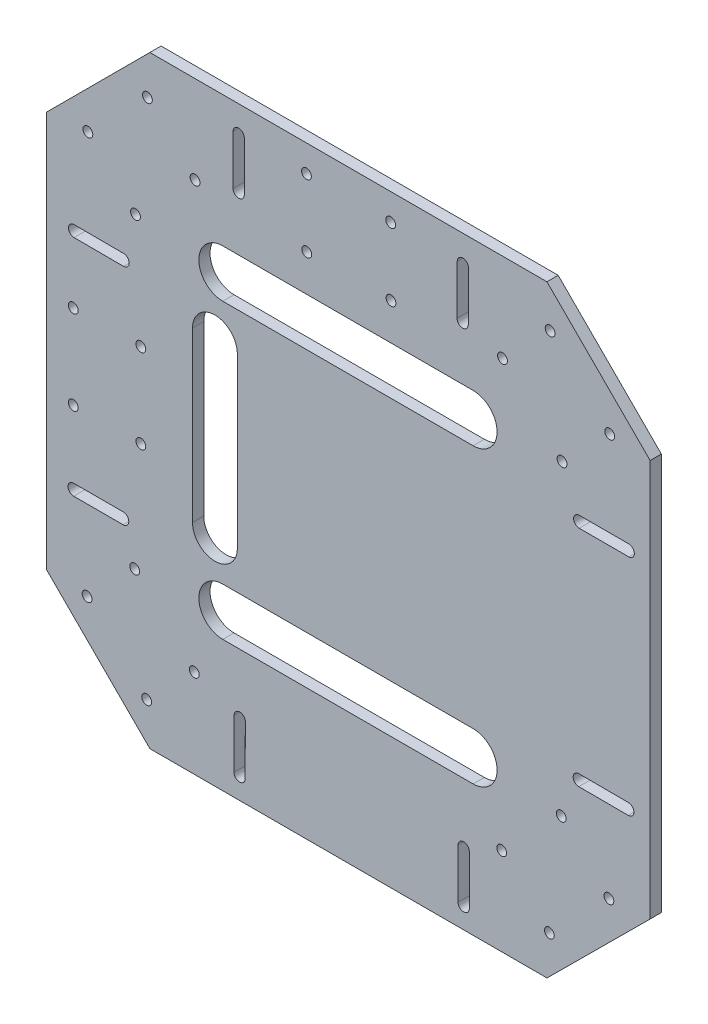
from build123d import *

# Parameters (mm, degrees)
SKETCH1_R           = 1.75
BOSS_EXTRUDE2_DEPTH = 4


with BuildPart() as part:
    # Sketch1 → Boss-Extrude2 (new body)
    with BuildSketch(Plane.XY):
        Polygon((-73.597643579, 117.281365478), (-102.391031709, 88.487977348), (-110.367196201, 80.511812856), (-110.367196201, -60.702096755), (-73.566769484, -97.50252168), (67.894125273, -97.50252168), (104.632803799, -60.949081901), (104.632803799, 80.511812856), (67.863251178, 117.281365478), align=None)
        with BuildLine():
            Line((-43.645260182, -89.805796249), (-43.573970383, -72.160845622))
            ThreePointArc((-43.573970383, -72.160845622), (-41.565906296, -70.168942355), (-39.574003029, -72.177006442))
            Line((-39.574003029, -72.177006442), (-39.645292829, -89.821957069))
            ThreePointArc((-39.645292829, -89.821957069), (-41.653356916, -91.813860335), (-43.645260182, -89.805796249))
        make_face(mode=Mode.SUBTRACT)
        with BuildLine():
            ThreePointArc((-83.098126059, -29.179247031), (-81.098126059, -31.179247031), (-83.098126059, -33.179247031))
            Line((-83.098126059, -33.179247031), (-100.743220699, -33.179247031))
            ThreePointArc((-100.743220699, -33.179247031), (-102.743220699, -31.179247031), (-100.743220699, -29.179247031))
            Line((-100.743220699, -29.179247031), (-83.098126059, -29.179247031))
        make_face(mode=Mode.SUBTRACT)
        with BuildLine():
            Line((41.576775637, -50.792305062), (-47.610288665, -50.792305062))
            ThreePointArc((-47.610288665, -50.792305062), (-56.142071455, -42.260522272), (-47.610288665, -33.728739482))
            Line((-47.610288665, -33.728739482), (41.576775637, -33.728739482))
            ThreePointArc((41.576775637, -33.728739482), (50.108558427, -42.260522272), (41.576775637, -50.792305062))
        make_face(mode=Mode.SUBTRACT)
        with BuildLine():
            ThreePointArc((36.21690933, -72.326072256), (38.21690933, -70.326072256), (40.21690933, -72.326072256))
            Line((40.21690933, -72.326072256), (40.21690933, -89.971166897))
            ThreePointArc((40.21690933, -89.971166897), (38.21690933, -91.971166897), (36.21690933, -89.971166897))
            Line((36.21690933, -89.971166897), (36.21690933, -72.326072256))
        make_face(mode=Mode.SUBTRACT)
        with Locations((68.725922349, -83.173950261)):
            Circle(SKETCH1_R, mode=Mode.SUBTRACT)
        with Locations((51.7553596, -66.203387512)):
            Circle(SKETCH1_R, mode=Mode.SUBTRACT)
        with Locations((72.968563036, -44.990184077)):
            Circle(SKETCH1_R, mode=Mode.SUBTRACT)
        with Locations((89.939125785, -61.960746825)):
            Circle(SKETCH1_R, mode=Mode.SUBTRACT)
        with BuildLine():
            Line((96.843458548, -32.87320638), (79.198507921, -32.801916581))
            ThreePointArc((79.198507921, -32.801916581), (77.206604654, -30.793852494), (79.214668741, -28.801949227))
            Line((79.214668741, -28.801949227), (96.859619368, -28.873239027))
            ThreePointArc((96.859619368, -28.873239027), (98.851522635, -30.881303113), (96.843458548, -32.87320638))
        make_face(mode=Mode.SUBTRACT)
        with BuildLine():
            Line((-100.577850051, 50.682922481), (-82.932899424, 50.611632682))
            ThreePointArc((-82.932899424, 50.611632682), (-80.940996157, 48.603568595), (-82.949060244, 46.611665329))
            Line((-82.949060244, 46.611665329), (-100.594010871, 46.682955128))
            ThreePointArc((-100.594010871, 46.682955128), (-102.585914138, 48.691019215), (-100.577850051, 50.682922481))
        make_face(mode=Mode.SUBTRACT)
        with BuildLine():
            ThreePointArc((-42.420907955, -20.095141949), (-50.403357017, -28.077591011), (-58.385806079, -20.095141949))
            Line((-58.385806079, -20.095141949), (-58.385806079, 39.904858051))
            ThreePointArc((-58.385806079, 39.904858051), (-50.403357017, 47.887307113), (-42.420907955, 39.904858051))
            Line((-42.420907955, 39.904858051), (-42.420907955, -20.095141949))
        make_face(mode=Mode.SUBTRACT)
        with BuildLine():
            ThreePointArc((-47.610288665, 53.538455583), (-56.142071455, 62.070238373), (-47.610288665, 70.602021163))
            Line((-47.610288665, 70.602021163), (41.576775637, 70.602021163))
            ThreePointArc((41.576775637, 70.602021163), (50.108558427, 62.070238373), (41.576775637, 53.538455583))
            Line((41.576775637, 53.538455583), (-47.610288665, 53.538455583))
        make_face(mode=Mode.SUBTRACT)
        with BuildLine():
            ThreePointArc((-39.951300834, 90.135788358), (-41.951300834, 88.135788358), (-43.951300834, 90.135788358))
            Line((-43.951300834, 90.135788358), (-43.951300834, 107.780882998))
            ThreePointArc((-43.951300834, 107.780882998), (-41.951300834, 109.780882998), (-39.951300834, 107.780882998))
            Line((-39.951300834, 107.780882998), (-39.951300834, 90.135788358))
        make_face(mode=Mode.SUBTRACT)
        with BuildLine():
            ThreePointArc((79.363734556, 46.988963133), (77.363734556, 48.988963133), (79.363734556, 50.988963133))
            Line((79.363734556, 50.988963133), (97.008829196, 50.988963133))
            ThreePointArc((97.008829196, 50.988963133), (99.008829196, 48.988963133), (97.008829196, 46.988963133))
            Line((97.008829196, 46.988963133), (79.363734556, 46.988963133))
        make_face(mode=Mode.SUBTRACT)
        with BuildLine():
            Line((39.910868679, 107.61551235), (39.83957888, 89.970561723))
            ThreePointArc((39.83957888, 89.970561723), (37.831514793, 87.978658457), (35.839611526, 89.986722543))
            Line((35.839611526, 89.986722543), (35.910901326, 107.63167317))
            ThreePointArc((35.910901326, 107.63167317), (37.918965413, 109.623576437), (39.910868679, 107.61551235))
        make_face(mode=Mode.SUBTRACT)
        with Locations((-17.807721775, 107.780882998)):
            Circle(SKETCH1_R, mode=Mode.SUBTRACT)
        with Locations((12.31576945, 83.712238659)):
            Circle(SKETCH1_R, mode=Mode.SUBTRACT)
        with Locations((12.192278225, 107.780882998)):
            Circle(SKETCH1_R, mode=Mode.SUBTRACT)
        with Locations((-17.68423055, 83.712238659)):
            Circle(SKETCH1_R, mode=Mode.SUBTRACT)
        with Locations((52.027846376, 85.740616838)):
            Circle(SKETCH1_R, mode=Mode.SUBTRACT)
        with Locations((90.21161256, 81.497976151)):
            Circle(SKETCH1_R, mode=Mode.SUBTRACT)
        with Locations((68.998409124, 102.711179587)):
            Circle(SKETCH1_R, mode=Mode.SUBTRACT)
        with Locations((73.241049811, 64.527413403)):
            Circle(SKETCH1_R, mode=Mode.SUBTRACT)
        with Locations((-95.946004063, -61.68826005)):
            Circle(SKETCH1_R, mode=Mode.SUBTRACT)
        with Locations((-57.762237879, -65.930900737)):
            Circle(SKETCH1_R, mode=Mode.SUBTRACT)
        with Locations((-78.975441314, -44.717697301)):
            Circle(SKETCH1_R, mode=Mode.SUBTRACT)
        with Locations((-74.732800627, -82.901463485)):
            Circle(SKETCH1_R, mode=Mode.SUBTRACT)
        with Locations((-76.798067586, -5.035667973)):
            Circle(SKETCH1_R, mode=Mode.SUBTRACT)
        with Locations((-100.866711924, 24.840840801)):
            Circle(SKETCH1_R, mode=Mode.SUBTRACT)
        with Locations((-76.798067586, 24.964332027)):
            Circle(SKETCH1_R, mode=Mode.SUBTRACT)
        with Locations((-100.866711924, -5.159159199)):
            Circle(SKETCH1_R, mode=Mode.SUBTRACT)
        with Locations((-57.489751103, 86.013103614)):
            Circle(SKETCH1_R, mode=Mode.SUBTRACT)
        with Locations((-74.460313852, 102.983666362)):
            Circle(SKETCH1_R, mode=Mode.SUBTRACT)
        with Locations((-95.673517288, 81.770462927)):
            Circle(SKETCH1_R, mode=Mode.SUBTRACT)
        with Locations((-78.702954539, 64.799900178)):
            Circle(SKETCH1_R, mode=Mode.SUBTRACT)
    extrude(amount=BOSS_EXTRUDE2_DEPTH)


solid = part.part
